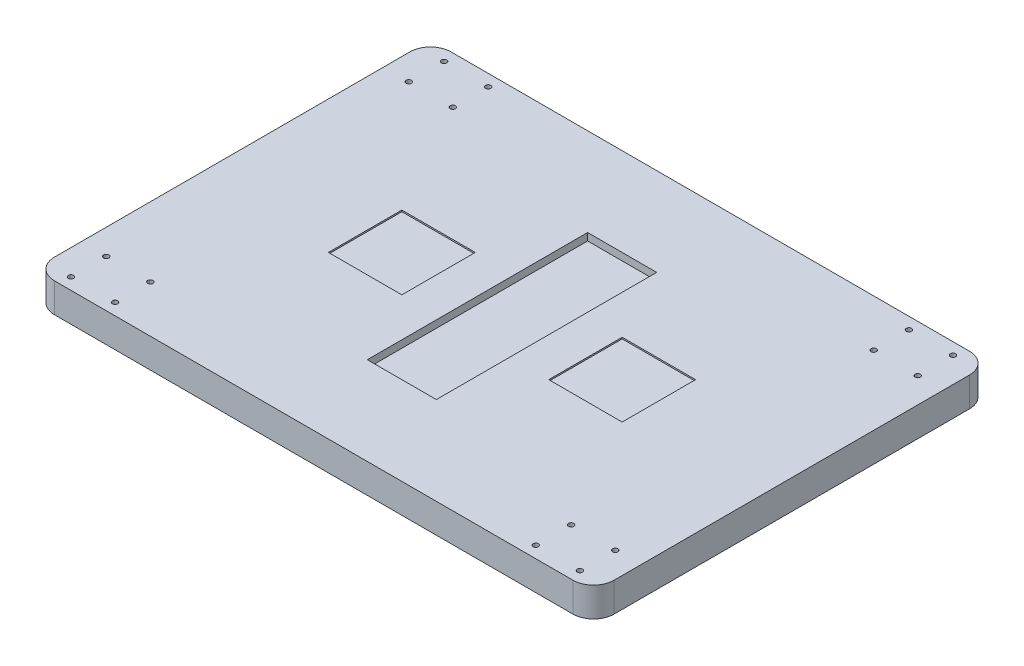
from build123d import *

# Parameters (mm, degrees)
SKETCH1_W                    = 381.012396694
SKETCH1_H                    = 270
BOSS_EXTRUDE1_DEPTH          = 20
FILLET1_R                    = 14
SKETCH2_W                    = 47
SKETCH2_H                    = 150
CUT_EXTRUDE1_DEPTH           = 5
M3_CLEARANCE_HOLE1_OUTLINE_R = 1.8
M3_CLEARANCE_HOLE1_DEPTH     = 20
SKETCH2_4_W                  = 47
SKETCH2_4_H                  = 150
SKETCH2_4_W_2                = 50
SKETCH2_4_H_2                = 50
CUT_EXTRUDE2_DEPTH           = 1
SKETCH5_W                    = 1.221153846
SKETCH5_H                    = 6.960576923
SKETCH5_H_2                  = 9.769230769
CUT_EXTRUDE3_DEPTH           = 2


# Read off the part's stored shape, not the designer's step: M3 Clearance Hole1
with BuildPart() as part:
    # Sketch1 → Boss-Extrude1 (new body)
    with BuildSketch(Plane(origin=(0, 0, 0), x_dir=(1, 0, 0), z_dir=(0, 1, 0))):
        with Locations((190.506198347, 135)):
            Rectangle(SKETCH1_W, SKETCH1_H)
    extrude(amount=BOSS_EXTRUDE1_DEPTH)

    # Fillet1
    fillet1_edges = [part.edges().sort_by_distance(p)[0] for p in [
        (0, 10, -270),
        (381.012396694, 10, -270),
        (381.012396694, 10, 0),
        (0, 10, 0),
    ]]
    fillet(fillet1_edges, radius=FILLET1_R)

    # Sketch2 → Cut-Extrude1 (cut)
    with BuildSketch(Plane(origin=(0, 20, 0), x_dir=(1, 0, 0), z_dir=(0, 1, 0))):
        with Locations((190.506198347, 135)):
            Rectangle(SKETCH2_W, SKETCH2_H)
    extrude(amount=-CUT_EXTRUDE1_DEPTH, mode=Mode.SUBTRACT)

    # M3 Clearance Hole1 outline → M3 Clearance Hole1 (cut)
    with BuildSketch(Plane(origin=(0, 0, 0), x_dir=(1, 0, 0), z_dir=(0, 1, 0))):
        with Locations((333.753629118, 238)):
            Circle(M3_CLEARANCE_HOLE1_OUTLINE_R)
        with Locations((333.753629118, 262)):
            Circle(M3_CLEARANCE_HOLE1_OUTLINE_R)
        with Locations((363.753629118, 262)):
            Circle(M3_CLEARANCE_HOLE1_OUTLINE_R)
        with Locations((363.753629118, 238)):
            Circle(M3_CLEARANCE_HOLE1_OUTLINE_R)
        with Locations((363.753629118, 32)):
            Circle(M3_CLEARANCE_HOLE1_OUTLINE_R)
        with Locations((363.753629118, 8)):
            Circle(M3_CLEARANCE_HOLE1_OUTLINE_R)
        with Locations((333.753629118, 32)):
            Circle(M3_CLEARANCE_HOLE1_OUTLINE_R)
        with Locations((333.753629118, 8)):
            Circle(M3_CLEARANCE_HOLE1_OUTLINE_R)
        with Locations((17.258767576, 8)):
            Circle(M3_CLEARANCE_HOLE1_OUTLINE_R)
        with Locations((17.258767576, 32)):
            Circle(M3_CLEARANCE_HOLE1_OUTLINE_R)
        with Locations((47.258767576, 32)):
            Circle(M3_CLEARANCE_HOLE1_OUTLINE_R)
        with Locations((47.258767576, 8)):
            Circle(M3_CLEARANCE_HOLE1_OUTLINE_R)
        with Locations((17.258767576, 238)):
            Circle(M3_CLEARANCE_HOLE1_OUTLINE_R)
        with Locations((47.258767576, 238)):
            Circle(M3_CLEARANCE_HOLE1_OUTLINE_R)
        with Locations((47.258767576, 262)):
            Circle(M3_CLEARANCE_HOLE1_OUTLINE_R)
        with Locations((17.258767576, 262)):
            Circle(M3_CLEARANCE_HOLE1_OUTLINE_R)
    extrude(amount=M3_CLEARANCE_HOLE1_DEPTH, mode=Mode.SUBTRACT)

    # Sketch2<4> → Cut-Extrude2 (cut)
    with BuildSketch(Plane(origin=(0, 20, 0), x_dir=(1, 0, 0), z_dir=(0, 1, 0))):
        with Locations((190.506198347, 135)):
            Rectangle(SKETCH2_4_W, SKETCH2_4_H)
        with Locations((115.506198347, 135)):
            Rectangle(SKETCH2_4_W_2, SKETCH2_4_H_2)
        with Locations((265.506198347, 135)):
            Rectangle(SKETCH2_4_W_2, SKETCH2_4_H_2)
    extrude(amount=-CUT_EXTRUDE2_DEPTH, mode=Mode.SUBTRACT)

    # Sketch5 → Cut-Extrude3 (cut)
    # profile 1 of 17: a face of its own
    with BuildSketch(Plane.XZ):
        Polygon((285.402063732, -143.548076923), (285.402063732, -144.525), (278.807832962, -144.525), (278.807832962, -143.548076923), (281.494371424, -143.548076923), (281.494371424, -135), (282.71552527, -135), (282.71552527, -143.548076923), align=None)
    # profile 2 of 17: a face of its own
    with BuildSketch(Plane.XZ):
        with BuildLine():
            Line((273.117256039, -144.769230769), (271.896102193, -144.769230769))
            Line((271.896102193, -144.769230769), (271.896102193, -140.645928486))
            add(Edge.make_bspline(
                [(271.896102193, -140.645928486), (271.780014918, -140.760952766), (271.551864203, -140.987014337), (271.176000165, -141.27978998), (270.784628752, -141.529070626), (270.3755603, -141.733037024), (269.948950475, -141.891050043), (269.504611539, -142.000325328), (269.04320053, -142.069784476), (268.729621089, -142.07834483), (268.570366015, -142.082692308)],
                knots=[0, 0, 0, 0, 1.051262509, 2.066085983, 3.059970449, 4.034092793, 5.003064597, 5.982190548, 6.97523131, 8, 8, 8, 8], degree=3))
            add(Edge.make_bspline(
                [(268.570366015, -142.082692308), (268.488910888, -142.081802444), (268.327677506, -142.080041036), (268.089576058, -142.059699538), (267.857438811, -142.030346778), (267.633123283, -141.985011687), (267.414180729, -141.933611041), (267.204519243, -141.863594611), (267.00137579, -141.783210651), (266.805246882, -141.692422663), (266.619497674, -141.589737099), (266.445424787, -141.479008274), (266.28309114, -141.360337991), (266.135799184, -141.230618719), (265.998467788, -141.094404804), (265.874746793, -140.94951171), (265.763055454, -140.796155941), (265.664507992, -140.631565948), (265.576537365, -140.450920967), (265.50374002, -140.248425913), (265.440421291, -140.023398474), (265.389654253, -139.77463301), (265.350344709, -139.502557209), (265.322043749, -139.207113698), (265.304890939, -138.888816609), (265.302900506, -138.668572048), (265.301871424, -138.554702524)],
                knots=[0, 0, 0, 0, 1.060090248, 2.098357, 3.108919151, 4.104307657, 5.07624491, 6.034544251, 6.978573164, 7.919437909, 8.84587468, 9.739351658, 10.603775763, 11.460552766, 12.291908634, 13.11991816, 13.938057932, 14.758791128, 15.614206832, 16.549371086, 17.555888866, 18.655217294, 19.85191054, 21.133015649, 22.517728915, 24, 24, 24, 24], degree=3))
            Line((265.301871424, -138.554702524), (265.301871424, -135))
            Line((265.301871424, -135), (266.52302527, -135))
            Line((266.52302527, -135), (266.52302527, -138.27421875))
            add(Edge.make_bspline(
                [(266.52302527, -138.27421875), (266.523358308, -138.368988372), (266.523995394, -138.550278221), (266.529670291, -138.809816467), (266.538982004, -139.044559748), (266.55189651, -139.255185674), (266.569343727, -139.440888527), (266.587299614, -139.602826865), (266.610744878, -139.739484534), (266.633147226, -139.821141339), (266.643232602, -139.857902644)],
                knots=[0, 0, 0, 0, 1.428537637, 2.732725584, 3.912935555, 4.969670097, 5.9131778, 6.72419638, 7.425642407, 8, 8, 8, 8], degree=3))
            add(Edge.make_bspline(
                [(266.643232602, -139.857902644), (266.661326438, -139.913599272), (266.696848091, -140.022942377), (266.766107066, -140.178114025), (266.846945566, -140.321786736), (266.936867193, -140.455805071), (267.035865739, -140.580745959), (267.147111922, -140.694029426), (267.270322152, -140.794708592), (267.402057161, -140.88765354), (267.546186172, -140.966804894), (267.699268447, -141.038439311), (267.864144675, -141.097453489), (268.039930005, -141.144174932), (268.225767811, -141.183074196), (268.422185568, -141.209162371), (268.629274656, -141.224318158), (268.770685584, -141.226675497), (268.843217578, -141.227884615)],
                knots=[0, 0, 0, 0, 1.001490693, 1.966117279, 2.901573967, 3.81913531, 4.725005841, 5.625368712, 6.529669049, 7.444386435, 8.379843123, 9.339052492, 10.333898936, 11.371400841, 12.449213347, 13.58042335, 14.758959286, 16, 16, 16, 16], degree=3))
            add(Edge.make_bspline(
                [(268.843217578, -141.227884615), (268.927234004, -141.226581337), (269.0937354, -141.223998537), (269.339897084, -141.198454024), (269.579151214, -141.156920603), (269.810989528, -141.096976221), (270.03653407, -141.02222274), (270.257135059, -140.933638225), (270.468403599, -140.823466266), (270.67236624, -140.70062594), (270.862493319, -140.56311729), (271.041825004, -140.421643249), (271.200130943, -140.267679127), (271.342388489, -140.107356303), (271.466504507, -139.938147018), (271.576833993, -139.762728805), (271.666434689, -139.577302143), (271.712753643, -139.448742737), (271.735825751, -139.384705529)],
                knots=[0, 0, 0, 0, 1.103287364, 2.186463942, 3.246815051, 4.290346497, 5.328614237, 6.366512181, 7.408972927, 8.454909442, 9.491158513, 10.489291136, 11.452369341, 12.387614776, 13.301610865, 14.205779579, 15.106274132, 16, 16, 16, 16], degree=3))
            add(Edge.make_bspline(
                [(271.735825751, -139.384705529), (271.749265957, -139.338453725), (271.778446809, -139.238033613), (271.809237099, -139.071238297), (271.835270681, -138.877583188), (271.858222023, -138.65744647), (271.874423968, -138.409832043), (271.888070654, -138.136333455), (271.895523588, -137.835408089), (271.89590357, -137.62612049), (271.896102193, -137.516721755)],
                knots=[0, 0, 0, 0, 0.614456878, 1.334084809, 2.161847829, 3.108567613, 4.158342329, 5.328722656, 6.603670911, 8, 8, 8, 8], degree=3))
            Line((271.896102193, -137.516721755), (271.896102193, -135))
            Line((271.896102193, -135), (273.117256039, -135))
            Line((273.117256039, -135), (273.117256039, -144.769230769))
        make_face()
    # profile 3 of 17: a face of its own
    with BuildSketch(Plane.XZ):
        with BuildLine():
            add(Edge.make_bspline(
                [(258.271841376, -144.891346154), (258.206106521, -144.888995765), (258.079043266, -144.884452543), (257.895164397, -144.842961607), (257.726869925, -144.774367158), (257.577160113, -144.681040047), (257.449402739, -144.571707239), (257.360916191, -144.441756282), (257.299436555, -144.303148964), (257.293890264, -144.204451875), (257.291102193, -144.15483774)],
                knots=[0, 0, 0, 0, 1.161947567, 2.246005398, 3.316126401, 4.362425386, 5.358802161, 6.264259363, 7.127458868, 8, 8, 8, 8], degree=3))
            add(Edge.make_bspline(
                [(257.291102193, -144.15483774), (257.293973185, -144.106507578), (257.299723961, -144.009699254), (257.360918257, -143.873495196), (257.450070468, -143.745461882), (257.577080828, -143.636207721), (257.726892135, -143.542957321), (257.895158345, -143.474341511), (258.079044915, -143.432856396), (258.206107083, -143.428312352), (258.271841376, -143.425961538)],
                knots=[0, 0, 0, 0, 0.854671362, 1.711959949, 2.612933713, 3.614565716, 4.666383233, 5.742148414, 6.831923931, 8, 8, 8, 8], degree=3))
            add(Edge.make_bspline(
                [(258.271841376, -143.425961538), (258.336286784, -143.428384651), (258.461421471, -143.433089646), (258.642439765, -143.473859743), (258.808039887, -143.544012729), (258.957263666, -143.635990984), (259.083804028, -143.746119059), (259.175389731, -143.872853303), (259.236226487, -144.009771898), (259.242044025, -144.106531768), (259.244948347, -144.15483774)],
                knots=[0, 0, 0, 0, 1.152406297, 2.237645894, 3.298861306, 4.35702004, 5.3646907, 6.277718956, 7.14017598, 8, 8, 8, 8], degree=3))
            add(Edge.make_bspline(
                [(259.244948347, -144.15483774), (259.242125721, -144.204427167), (259.23651069, -144.303075105), (259.175401077, -144.442395072), (259.084469609, -144.571058542), (258.957183664, -144.681254576), (258.808061808, -144.773311988), (258.642433776, -144.843443298), (258.461423092, -144.884219305), (258.336287335, -144.88892347), (258.271841376, -144.891346154)],
                knots=[0, 0, 0, 0, 0.877781059, 1.746164392, 2.663580443, 3.665940824, 4.718523215, 5.774146176, 6.853666717, 8, 8, 8, 8], degree=3))
        make_face()
    # profile 4 of 17: a face of its own
    with BuildSketch(Plane.XZ):
        with Locations((258.26802527, -138.480288462)):
            Rectangle(SKETCH5_W, SKETCH5_H)
    # profile 5 of 17: a face of its own
    with BuildSketch(Plane.XZ):
        with BuildLine():
            Line((246.83802527, -141.092412861), (247.578349789, -140.495192308))
            add(Edge.make_bspline(
                [(247.578349789, -140.495192308), (247.645634011, -140.55338161), (247.776250481, -140.666342437), (247.97922631, -140.815307813), (248.180114853, -140.942733972), (248.381101981, -141.046596605), (248.581225487, -141.126807366), (248.779751606, -141.18514809), (248.97754505, -141.221153983), (249.109735789, -141.225651075), (249.175390054, -141.227884615)],
                knots=[0, 0, 0, 0, 1.187891683, 2.306011931, 3.359687364, 4.362827326, 5.323627033, 6.235078112, 7.123428389, 8, 8, 8, 8], degree=3))
            add(Edge.make_bspline(
                [(249.175390054, -141.227884615), (249.255227882, -141.224969609), (249.411086243, -141.219278973), (249.635477559, -141.163472399), (249.842400126, -141.075596177), (250.026205891, -140.954069554), (250.179330044, -140.809326221), (250.296785791, -140.650059504), (250.365407952, -140.473636744), (250.374709117, -140.352001566), (250.379371424, -140.291030649)],
                knots=[0, 0, 0, 0, 1.136779825, 2.219206672, 3.275667648, 4.329789593, 5.343525384, 6.267229628, 7.131430556, 8, 8, 8, 8], degree=3))
            add(Edge.make_bspline(
                [(250.379371424, -140.291030649), (250.375702533, -140.235812529), (250.368293736, -140.124307464), (250.305684681, -139.961101483), (250.206853353, -139.802743587), (250.117320188, -139.708823816), (250.070266857, -139.659465144)],
                knots=[0, 0, 0, 0, 0.915304622, 1.848326266, 2.869207656, 4, 4, 4, 4], degree=3))
            add(Edge.make_bspline(
                [(250.070266857, -139.659465144), (250.041425759, -139.632898502), (249.979165819, -139.575548481), (249.86964631, -139.494298506), (249.7389146, -139.41083209), (249.587586182, -139.322622898), (249.414291356, -139.23258368), (249.221157818, -139.135865337), (249.005240839, -139.039714966), (248.853669264, -138.975495992), (248.774698948, -138.94203726)],
                knots=[0, 0, 0, 0, 0.63212743, 1.364588004, 2.195464086, 3.133262597, 4.188693409, 5.344814424, 6.6166216, 8, 8, 8, 8], degree=3))
            add(Edge.make_bspline(
                [(248.774698948, -138.94203726), (248.678452462, -138.900528409), (248.492586467, -138.820368767), (248.227277181, -138.696923902), (247.986182867, -138.573593153), (247.771115462, -138.448446428), (247.576850865, -138.329895725), (247.408389051, -138.208849289), (247.262247991, -138.090326949), (247.17888087, -138.005287464), (247.139497626, -137.965114183)],
                knots=[0, 0, 0, 0, 1.312114962, 2.533885256, 3.662744578, 4.700700231, 5.648498512, 6.510216311, 7.296215166, 8, 8, 8, 8], degree=3))
            add(Edge.make_bspline(
                [(247.139497626, -137.965114183), (247.074397951, -137.885311539), (246.94706695, -137.729222428), (246.816898968, -137.460981672), (246.730229677, -137.180544723), (246.720721137, -136.986936625), (246.715909886, -136.888972356)],
                knots=[0, 0, 0, 0, 1.042420968, 2.038911939, 3.007703917, 4, 4, 4, 4], degree=3))
            add(Edge.make_bspline(
                [(246.715909886, -136.888972356), (246.717852178, -136.82009876), (246.721692854, -136.68390852), (246.760152838, -136.484264749), (246.81797436, -136.291801528), (246.90501156, -136.109681688), (247.008704476, -135.931898671), (247.142338254, -135.766248042), (247.29896498, -135.609268219), (247.474762947, -135.459156601), (247.669402529, -135.323740265), (247.87746965, -135.204268357), (248.097437086, -135.102395232), (248.330582083, -135.021703256), (248.574484587, -134.955494837), (248.830564039, -134.910523349), (249.098487672, -134.883598406), (249.280905334, -134.879812916), (249.373827554, -134.877884615)],
                knots=[0, 0, 0, 0, 0.892388946, 1.764604599, 2.628351177, 3.492097755, 4.376403335, 5.292503137, 6.243418865, 7.25013864, 8.286935251, 9.314334271, 10.359011649, 11.426217399, 12.510883189, 13.633993454, 14.794773606, 16, 16, 16, 16], degree=3))
            add(Edge.make_bspline(
                [(249.373827554, -134.877884615), (249.499289436, -134.880561525), (249.747959543, -134.885867259), (250.116146137, -134.936195362), (250.47602713, -135.013164756), (250.822933272, -135.124066728), (251.151499581, -135.259889658), (251.454659946, -135.419957043), (251.728683152, -135.604319201), (251.888318319, -135.74917986), (251.966871424, -135.82046274)],
                knots=[0, 0, 0, 0, 1.06569098, 2.112239068, 3.152290447, 4.18992323, 5.202764126, 6.169967771, 7.099479667, 8, 8, 8, 8], degree=3))
            Line((251.966871424, -135.82046274), (251.243719381, -136.465384615))
            add(Edge.make_bspline(
                [(251.243719381, -136.465384615), (251.175247465, -136.407070637), (251.041455187, -136.293126695), (250.830305142, -136.143617347), (250.616075646, -136.016784142), (250.397733859, -135.91304354), (250.175969929, -135.832609092), (249.951121377, -135.774947059), (249.723506452, -135.739332575), (249.570482197, -135.73490448), (249.494034886, -135.732692308)],
                knots=[0, 0, 0, 0, 1.111927383, 2.17267613, 3.195288797, 4.187559573, 5.158013992, 6.108138625, 7.054870644, 8, 8, 8, 8], degree=3))
            add(Edge.make_bspline(
                [(249.494034886, -135.732692308), (249.390006824, -135.736420714), (249.18755855, -135.74367654), (248.8966992, -135.808747708), (248.628111891, -135.911634099), (248.427655215, -136.034896154), (248.285742241, -136.148866862), (248.19214936, -136.237376868), (248.114144668, -136.330333282), (248.0501301, -136.427930414), (247.997734453, -136.527527169), (247.963429836, -136.633450936), (247.941873866, -136.741807843), (247.938667901, -136.815730596), (247.937063732, -136.852719351)],
                knots=[0, 0, 0, 0, 1.76855631, 3.441774896, 5.045983248, 6.644520092, 7.422219082, 8.141926103, 8.833567701, 9.482099588, 10.126007141, 10.742200638, 11.370634467, 12, 12, 12, 12], degree=3))
            add(Edge.make_bspline(
                [(247.937063732, -136.852719351), (247.940546117, -136.913660733), (247.947452388, -137.034519765), (248.009585186, -137.208967581), (248.105198032, -137.374372353), (248.195610372, -137.468209407), (248.242352193, -137.516721755)],
                knots=[0, 0, 0, 0, 0.970753053, 1.925198784, 2.927358944, 4, 4, 4, 4], degree=3))
            add(Edge.make_bspline(
                [(248.242352193, -137.516721755), (248.271203039, -137.541416556), (248.334794903, -137.595847836), (248.448901318, -137.672614402), (248.585039863, -137.756721006), (248.74748448, -137.840808614), (248.929483041, -137.936152411), (249.138984503, -138.029903774), (249.371113493, -138.131086351), (249.534622571, -138.198804206), (249.619966376, -138.234149639)],
                knots=[0, 0, 0, 0, 0.584144934, 1.28754858, 2.113654268, 3.046613042, 4.10183206, 5.2758917, 6.578147661, 8, 8, 8, 8], degree=3))
            add(Edge.make_bspline(
                [(249.619966376, -138.234149639), (249.712504056, -138.273511029), (249.890654115, -138.349288097), (250.143579755, -138.470425673), (250.373797167, -138.590304531), (250.582573801, -138.707296692), (250.766682625, -138.826752515), (250.929272319, -138.943485411), (251.067868898, -139.062261406), (251.148234315, -139.144991309), (251.186477794, -139.184359976)],
                knots=[0, 0, 0, 0, 1.307990047, 2.518093226, 3.646744414, 4.68422955, 5.629722174, 6.500166002, 7.286274211, 8, 8, 8, 8], degree=3))
            add(Edge.make_bspline(
                [(251.186477794, -139.184359976), (251.250063204, -139.263008324), (251.37460902, -139.417058173), (251.505414168, -139.682013822), (251.58493324, -139.963968448), (251.595280226, -140.158217769), (251.60052527, -140.256685697)],
                knots=[0, 0, 0, 0, 1.03036624, 2.018195775, 2.995393363, 4, 4, 4, 4], degree=3))
            add(Edge.make_bspline(
                [(251.60052527, -140.256685697), (251.599159404, -140.321097241), (251.596476702, -140.44760811), (251.561367153, -140.632208838), (251.511360729, -140.809938871), (251.434816848, -140.97786524), (251.342147377, -141.140305466), (251.223259637, -141.290437567), (251.087808269, -141.435619992), (250.929074342, -141.566799389), (250.757493779, -141.688572652), (250.572486567, -141.79385898), (250.377540564, -141.884351798), (250.170117204, -141.956161991), (249.952168343, -142.014189642), (249.722184146, -142.052993576), (249.481916141, -142.079053344), (249.317930051, -142.081465617), (249.234539693, -142.082692308)],
                knots=[0, 0, 0, 0, 0.926790944, 1.820312323, 2.6990465, 3.581215108, 4.472477501, 5.38722695, 6.333746693, 7.328848171, 8.348464033, 9.362462589, 10.391753375, 11.441047168, 12.521420338, 13.637924818, 14.798835342, 16, 16, 16, 16], degree=3))
            add(Edge.make_bspline(
                [(249.234539693, -142.082692308), (249.135154917, -142.079701538), (248.935348052, -142.073688784), (248.635353991, -142.025996715), (248.335323382, -141.947141364), (248.034704398, -141.837483404), (247.734210569, -141.697363425), (247.43404065, -141.525641076), (247.131072003, -141.325996211), (246.937351505, -141.171584379), (246.83802527, -141.092412861)],
                knots=[0, 0, 0, 0, 0.901438579, 1.812285774, 2.748697099, 3.712587738, 4.71176503, 5.753243045, 6.848021186, 8, 8, 8, 8], degree=3))
        make_face()
    # profile 6 of 17: a face of its own
    with BuildSketch(Plane.XZ):
        with BuildLine():
            add(Edge.make_bspline(
                [(231.308764453, -144.891346154), (231.243029598, -144.888995765), (231.115966342, -144.884452543), (230.932087474, -144.842961607), (230.763793002, -144.774367158), (230.614083189, -144.681040047), (230.486325816, -144.571707239), (230.397839268, -144.441756282), (230.336359632, -144.303148964), (230.330813341, -144.204451875), (230.32802527, -144.15483774)],
                knots=[0, 0, 0, 0, 1.161947567, 2.246005398, 3.316126401, 4.362425386, 5.358802161, 6.264259363, 7.127458868, 8, 8, 8, 8], degree=3))
            add(Edge.make_bspline(
                [(230.32802527, -144.15483774), (230.330896262, -144.106507578), (230.336647038, -144.009699254), (230.397841334, -143.873495196), (230.486993545, -143.745461882), (230.614003905, -143.636207721), (230.763815212, -143.542957321), (230.932081422, -143.474341511), (231.115967992, -143.432856396), (231.24303016, -143.428312352), (231.308764453, -143.425961538)],
                knots=[0, 0, 0, 0, 0.854671362, 1.711959949, 2.612933713, 3.614565716, 4.666383233, 5.742148414, 6.831923931, 8, 8, 8, 8], degree=3))
            add(Edge.make_bspline(
                [(231.308764453, -143.425961538), (231.373209861, -143.428384651), (231.498344548, -143.433089646), (231.679362842, -143.473859743), (231.844962964, -143.544012729), (231.994186743, -143.635990984), (232.120727105, -143.746119059), (232.212312808, -143.872853303), (232.273149564, -144.009771898), (232.278967102, -144.106531768), (232.281871424, -144.15483774)],
                knots=[0, 0, 0, 0, 1.152406297, 2.237645894, 3.298861306, 4.35702004, 5.3646907, 6.277718956, 7.14017598, 8, 8, 8, 8], degree=3))
            add(Edge.make_bspline(
                [(232.281871424, -144.15483774), (232.279048798, -144.204427167), (232.273433767, -144.303075105), (232.212324154, -144.442395072), (232.121392686, -144.571058542), (231.994106741, -144.681254576), (231.844984885, -144.773311988), (231.679356853, -144.843443298), (231.498346169, -144.884219305), (231.373210412, -144.88892347), (231.308764453, -144.891346154)],
                knots=[0, 0, 0, 0, 0.877781059, 1.746164392, 2.663580443, 3.665940824, 4.718523215, 5.774146176, 6.853666717, 8, 8, 8, 8], degree=3))
        make_face()
    # profile 7 of 17: a face of its own
    with BuildSketch(Plane.XZ):
        with Locations((231.304948347, -138.480288462)):
            Rectangle(SKETCH5_W, SKETCH5_H)
    # profile 8 of 17: a face of its own
    with BuildSketch(Plane.XZ):
        with BuildLine():
            Line((219.874948347, -141.092412861), (220.615272866, -140.495192308))
            add(Edge.make_bspline(
                [(220.615272866, -140.495192308), (220.682557088, -140.55338161), (220.813173558, -140.666342437), (221.016149387, -140.815307813), (221.21703793, -140.942733972), (221.418025058, -141.046596605), (221.618148564, -141.126807366), (221.816674683, -141.18514809), (222.014468127, -141.221153983), (222.146658866, -141.225651075), (222.212313131, -141.227884615)],
                knots=[0, 0, 0, 0, 1.187891683, 2.306011931, 3.359687364, 4.362827326, 5.323627033, 6.235078112, 7.123428389, 8, 8, 8, 8], degree=3))
            add(Edge.make_bspline(
                [(222.212313131, -141.227884615), (222.292150959, -141.224969609), (222.44800932, -141.219278973), (222.672400636, -141.163472399), (222.879323203, -141.075596177), (223.063128968, -140.954069554), (223.216253121, -140.809326221), (223.333708868, -140.650059504), (223.402331029, -140.473636744), (223.411632194, -140.352001566), (223.416294501, -140.291030649)],
                knots=[0, 0, 0, 0, 1.136779825, 2.219206672, 3.275667648, 4.329789593, 5.343525384, 6.267229628, 7.131430556, 8, 8, 8, 8], degree=3))
            add(Edge.make_bspline(
                [(223.416294501, -140.291030649), (223.41262561, -140.235812529), (223.405216813, -140.124307464), (223.342607758, -139.961101483), (223.24377643, -139.802743587), (223.154243265, -139.708823816), (223.107189934, -139.659465144)],
                knots=[0, 0, 0, 0, 0.915304622, 1.848326266, 2.869207656, 4, 4, 4, 4], degree=3))
            add(Edge.make_bspline(
                [(223.107189934, -139.659465144), (223.078348836, -139.632898502), (223.016088896, -139.575548481), (222.906569386, -139.494298506), (222.775837677, -139.41083209), (222.624509259, -139.322622898), (222.451214433, -139.23258368), (222.258080895, -139.135865337), (222.042163916, -139.039714966), (221.890592341, -138.975495992), (221.811622025, -138.94203726)],
                knots=[0, 0, 0, 0, 0.63212743, 1.364588004, 2.195464086, 3.133262597, 4.188693409, 5.344814424, 6.6166216, 8, 8, 8, 8], degree=3))
            add(Edge.make_bspline(
                [(221.811622025, -138.94203726), (221.715375539, -138.900528409), (221.529509543, -138.820368767), (221.264200258, -138.696923902), (221.023105944, -138.573593153), (220.808038538, -138.448446428), (220.613773942, -138.329895725), (220.445312128, -138.208849289), (220.299171068, -138.090326949), (220.215803947, -138.005287464), (220.176420703, -137.965114183)],
                knots=[0, 0, 0, 0, 1.312114962, 2.533885256, 3.662744578, 4.700700231, 5.648498512, 6.510216311, 7.296215166, 8, 8, 8, 8], degree=3))
            add(Edge.make_bspline(
                [(220.176420703, -137.965114183), (220.111321028, -137.885311539), (219.983990027, -137.729222428), (219.853822045, -137.460981672), (219.767152754, -137.180544723), (219.757644214, -136.986936625), (219.752832962, -136.888972356)],
                knots=[0, 0, 0, 0, 1.042420968, 2.038911939, 3.007703917, 4, 4, 4, 4], degree=3))
            add(Edge.make_bspline(
                [(219.752832962, -136.888972356), (219.754775254, -136.82009876), (219.758615931, -136.68390852), (219.797075915, -136.484264749), (219.854897437, -136.291801528), (219.941934637, -136.109681688), (220.045627553, -135.931898671), (220.179261331, -135.766248042), (220.335888056, -135.609268219), (220.511686024, -135.459156601), (220.706325606, -135.323740265), (220.914392727, -135.204268357), (221.134360163, -135.102395232), (221.36750516, -135.021703256), (221.611407664, -134.955494837), (221.867487116, -134.910523349), (222.135410749, -134.883598406), (222.317828411, -134.879812916), (222.410750631, -134.877884615)],
                knots=[0, 0, 0, 0, 0.892388946, 1.764604599, 2.628351177, 3.492097755, 4.376403335, 5.292503137, 6.243418865, 7.25013864, 8.286935251, 9.314334271, 10.359011649, 11.426217399, 12.510883189, 13.633993454, 14.794773606, 16, 16, 16, 16], degree=3))
            add(Edge.make_bspline(
                [(222.410750631, -134.877884615), (222.536212513, -134.880561525), (222.78488262, -134.885867259), (223.153069214, -134.936195362), (223.512950207, -135.013164756), (223.859856348, -135.124066728), (224.188422658, -135.259889658), (224.491583023, -135.419957043), (224.765606229, -135.604319201), (224.925241396, -135.74917986), (225.003794501, -135.82046274)],
                knots=[0, 0, 0, 0, 1.06569098, 2.112239068, 3.152290447, 4.18992323, 5.202764126, 6.169967771, 7.099479667, 8, 8, 8, 8], degree=3))
            Line((225.003794501, -135.82046274), (224.280642458, -136.465384615))
            add(Edge.make_bspline(
                [(224.280642458, -136.465384615), (224.212170542, -136.407070637), (224.078378264, -136.293126695), (223.867228219, -136.143617347), (223.652998723, -136.016784142), (223.434656936, -135.91304354), (223.212893006, -135.832609092), (222.988044454, -135.774947059), (222.760429529, -135.739332575), (222.607405274, -135.73490448), (222.530957962, -135.732692308)],
                knots=[0, 0, 0, 0, 1.111927383, 2.17267613, 3.195288797, 4.187559573, 5.158013992, 6.108138625, 7.054870644, 8, 8, 8, 8], degree=3))
            add(Edge.make_bspline(
                [(222.530957962, -135.732692308), (222.426929901, -135.736420714), (222.224481627, -135.74367654), (221.933622277, -135.808747708), (221.665034968, -135.911634099), (221.464578292, -136.034896154), (221.322665318, -136.148866862), (221.229072437, -136.237376868), (221.151067745, -136.330333282), (221.087053177, -136.427930414), (221.03465753, -136.527527169), (221.000352913, -136.633450936), (220.978796943, -136.741807843), (220.975590978, -136.815730596), (220.973986809, -136.852719351)],
                knots=[0, 0, 0, 0, 1.76855631, 3.441774896, 5.045983248, 6.644520092, 7.422219082, 8.141926103, 8.833567701, 9.482099588, 10.126007141, 10.742200638, 11.370634467, 12, 12, 12, 12], degree=3))
            add(Edge.make_bspline(
                [(220.973986809, -136.852719351), (220.977469194, -136.913660733), (220.984375465, -137.034519765), (221.046508263, -137.208967581), (221.142121108, -137.374372353), (221.232533449, -137.468209407), (221.27927527, -137.516721755)],
                knots=[0, 0, 0, 0, 0.970753053, 1.925198784, 2.927358944, 4, 4, 4, 4], degree=3))
            add(Edge.make_bspline(
                [(221.27927527, -137.516721755), (221.308126116, -137.541416556), (221.37171798, -137.595847836), (221.485824395, -137.672614402), (221.62196294, -137.756721006), (221.784407557, -137.840808614), (221.966406118, -137.936152411), (222.17590758, -138.029903774), (222.40803657, -138.131086351), (222.571545648, -138.198804206), (222.656889453, -138.234149639)],
                knots=[0, 0, 0, 0, 0.584144934, 1.28754858, 2.113654268, 3.046613042, 4.10183206, 5.2758917, 6.578147661, 8, 8, 8, 8], degree=3))
            add(Edge.make_bspline(
                [(222.656889453, -138.234149639), (222.749427133, -138.273511029), (222.927577192, -138.349288097), (223.180502832, -138.470425673), (223.410720244, -138.590304531), (223.619496878, -138.707296692), (223.803605702, -138.826752515), (223.966195396, -138.943485411), (224.104791975, -139.062261406), (224.185157392, -139.144991309), (224.223400871, -139.184359976)],
                knots=[0, 0, 0, 0, 1.307990047, 2.518093226, 3.646744414, 4.68422955, 5.629722174, 6.500166002, 7.286274211, 8, 8, 8, 8], degree=3))
            add(Edge.make_bspline(
                [(224.223400871, -139.184359976), (224.28698628, -139.263008324), (224.411532097, -139.417058173), (224.542337245, -139.682013822), (224.621856317, -139.963968448), (224.632203303, -140.158217769), (224.637448347, -140.256685697)],
                knots=[0, 0, 0, 0, 1.03036624, 2.018195775, 2.995393363, 4, 4, 4, 4], degree=3))
            add(Edge.make_bspline(
                [(224.637448347, -140.256685697), (224.636082481, -140.321097241), (224.633399779, -140.44760811), (224.59829023, -140.632208838), (224.548283806, -140.809938871), (224.471739924, -140.97786524), (224.379070454, -141.140305466), (224.260182714, -141.290437567), (224.124731345, -141.435619992), (223.965997419, -141.566799389), (223.794416856, -141.688572652), (223.609409644, -141.79385898), (223.414463641, -141.884351798), (223.207040281, -141.956161991), (222.98909142, -142.014189642), (222.759107223, -142.052993576), (222.518839218, -142.079053344), (222.354853128, -142.081465617), (222.27146277, -142.082692308)],
                knots=[0, 0, 0, 0, 0.926790944, 1.820312323, 2.6990465, 3.581215108, 4.472477501, 5.38722695, 6.333746693, 7.328848171, 8.348464033, 9.362462589, 10.391753375, 11.441047168, 12.521420338, 13.637924818, 14.798835342, 16, 16, 16, 16], degree=3))
            add(Edge.make_bspline(
                [(222.27146277, -142.082692308), (222.172077994, -142.079701538), (221.972271129, -142.073688784), (221.672277068, -142.025996715), (221.372246459, -141.947141364), (221.071627475, -141.837483404), (220.771133646, -141.697363425), (220.470963727, -141.525641076), (220.16799508, -141.325996211), (219.974274582, -141.171584379), (219.874948347, -141.092412861)],
                knots=[0, 0, 0, 0, 0.901438579, 1.812285774, 2.748697099, 3.712587738, 4.71176503, 5.753243045, 6.848021186, 8, 8, 8, 8], degree=3))
        make_face()
    # profile 9 of 17: a face of its own
    with BuildSketch(Plane.XZ):
        with BuildLine():
            Line((205.196679116, -141.960576923), (203.97552527, -141.960576923))
            Line((203.97552527, -141.960576923), (203.97552527, -140.935952524))
            add(Edge.make_bspline(
                [(203.97552527, -140.935952524), (203.889484983, -141.031760381), (203.723042845, -141.217097565), (203.452065375, -141.459852537), (203.173042153, -141.659592436), (202.886388266, -141.817694267), (202.593924212, -141.936679571), (202.295867001, -142.021501108), (201.990989045, -142.072356914), (201.785268156, -142.079239103), (201.682045703, -142.082692308)],
                knots=[0, 0, 0, 0, 1.165123147, 2.253892832, 3.285998974, 4.265245787, 5.210434991, 6.138153436, 7.065800409, 8, 8, 8, 8], degree=3))
            add(Edge.make_bspline(
                [(201.682045703, -142.082692308), (201.602352637, -142.07949041), (201.439289908, -142.072938896), (201.191135729, -142.02622782), (200.934451118, -141.952384285), (200.765515289, -141.880994931), (200.678409886, -141.844185697)],
                knots=[0, 0, 0, 0, 0.92031039, 1.883078821, 2.90848924, 4, 4, 4, 4], degree=3))
            Line((200.678409886, -141.844185697), (201.279446544, -141.103861178))
            add(Edge.make_bspline(
                [(201.279446544, -141.103861178), (201.335879125, -141.122236898), (201.443509781, -141.157283866), (201.599774478, -141.198458), (201.74298487, -141.222565388), (201.833979295, -141.226186064), (201.876667097, -141.227884615)],
                knots=[0, 0, 0, 0, 1.162551218, 2.217267876, 3.163674949, 4, 4, 4, 4], degree=3))
            add(Edge.make_bspline(
                [(201.876667097, -141.227884615), (201.970600558, -141.223526374), (202.159067946, -141.214782031), (202.436843073, -141.141559526), (202.709903588, -141.027973827), (202.927212835, -140.894579447), (203.096421059, -140.768326867), (203.214917283, -140.655442157), (203.327670921, -140.532576175), (203.430143168, -140.395099593), (203.529459909, -140.248420366), (203.615386515, -140.085488935), (203.696392387, -139.911874248), (203.742261407, -139.790179277), (203.765639453, -139.728155048)],
                knots=[0, 0, 0, 0, 1.310358642, 2.62909372, 3.987049435, 5.429972903, 6.178062671, 6.932352039, 7.712263136, 8.504774094, 9.325324213, 10.183996177, 11.074438036, 12, 12, 12, 12], degree=3))
            add(Edge.make_bspline(
                [(203.765639453, -139.728155048), (203.783243153, -139.673098763), (203.822214713, -139.551213632), (203.860251334, -139.345406349), (203.897108757, -139.103060682), (203.926794608, -138.823561908), (203.949400964, -138.505376134), (203.963448629, -138.150296174), (203.973249964, -137.757190595), (203.974742655, -137.483019874), (203.97552527, -137.339272837)],
                knots=[0, 0, 0, 0, 0.576069428, 1.275318486, 2.083729819, 3.021840842, 4.077732557, 5.265190297, 6.566145967, 8, 8, 8, 8], degree=3))
            Line((203.97552527, -137.339272837), (203.97552527, -135))
            Line((203.97552527, -135), (205.196679116, -135))
            Line((205.196679116, -135), (205.196679116, -141.960576923))
        make_face()
    # profile 10 of 17: a face of its own
    with BuildSketch(Plane.XZ):
        with BuildLine():
            Line((188.143647265, -137.198076923), (187.172448347, -136.79929387))
            add(Edge.make_bspline(
                [(187.172448347, -136.79929387), (187.253258429, -136.691554424), (187.412155211, -136.479706459), (187.679452886, -136.192351406), (187.964268854, -135.937341521), (188.269149768, -135.714222945), (188.592405938, -135.519079314), (188.936181279, -135.351711103), (189.297051319, -135.205508617), (189.679587076, -135.087399801), (190.084505671, -134.993870749), (190.514044922, -134.925222791), (190.969344536, -134.885226397), (191.28104226, -134.880372072), (191.44076265, -134.877884615)],
                knots=[0, 0, 0, 0, 0.993832375, 1.954171591, 2.89207794, 3.81254052, 4.739508638, 5.676179777, 6.63279174, 7.611599397, 8.628821328, 9.698858787, 10.820847428, 12, 12, 12, 12], degree=3))
            add(Edge.make_bspline(
                [(191.44076265, -134.877884615), (191.61770723, -134.881008623), (191.962840726, -134.887102053), (192.465493261, -134.939425931), (192.938570431, -135.024104358), (193.381834449, -135.144444667), (193.7957636, -135.29844526), (194.179930803, -135.488498845), (194.535137163, -135.711823939), (194.855559875, -135.969569725), (195.141746707, -136.247714633), (195.395924659, -136.534890937), (195.608152128, -136.834283985), (195.785347967, -137.140977004), (195.917551581, -137.459327551), (196.01763306, -137.784603845), (196.075784369, -138.120119196), (196.083163839, -138.34714558), (196.086871424, -138.461207933)],
                knots=[0, 0, 0, 0, 1.300612567, 2.536867552, 3.710854085, 4.830463784, 5.909164272, 6.952669701, 7.976214594, 8.987639489, 9.969791403, 10.90762051, 11.802890735, 12.663594676, 13.506004026, 14.331449409, 15.161688597, 16, 16, 16, 16], degree=3))
            add(Edge.make_bspline(
                [(196.086871424, -138.461207933), (196.083275536, -138.568222424), (196.076133911, -138.780758939), (196.027872919, -139.095176227), (195.94536642, -139.401134278), (195.827471431, -139.696993348), (195.680559186, -139.985817889), (195.496539142, -140.262795951), (195.283403937, -140.533582674), (195.119256119, -140.700223156), (195.035534285, -140.785216346)],
                knots=[0, 0, 0, 0, 0.978930833, 1.944209111, 2.902605845, 3.871821944, 4.852894709, 5.861549757, 6.909306393, 8, 8, 8, 8], degree=3))
            add(Edge.make_bspline(
                [(195.035534285, -140.785216346), (194.921918291, -140.888931352), (194.695609211, -141.09551888), (194.317192034, -141.359720701), (193.911282648, -141.583103381), (193.477547267, -141.767783318), (193.015365791, -141.908087436), (192.525554768, -142.008960963), (192.007765061, -142.070850759), (191.652730494, -142.078687415), (191.471291496, -142.082692308)],
                knots=[0, 0, 0, 0, 0.947862433, 1.888025329, 2.83773608, 3.800788977, 4.789574255, 5.811087519, 6.881365014, 8, 8, 8, 8], degree=3))
            add(Edge.make_bspline(
                [(191.471291496, -142.082692308), (191.284087142, -142.079098517), (190.918672143, -142.07208359), (190.385150446, -142.004604928), (189.87977299, -141.900302759), (189.404464612, -141.747567034), (188.955669284, -141.557874076), (188.538970441, -141.319170465), (188.148905884, -141.040034123), (187.915609723, -140.822236472), (187.798289693, -140.712710337)],
                knots=[0, 0, 0, 0, 1.115394104, 2.177202216, 3.200349991, 4.187119838, 5.148390265, 6.099219593, 7.044135087, 8, 8, 8, 8], degree=3))
            add(Edge.make_bspline(
                [(187.798289693, -140.712710337), (187.720229768, -140.630896479), (187.566242595, -140.469504005), (187.366984778, -140.202798144), (187.195989243, -139.922982158), (187.059100279, -139.62559836), (186.946109675, -139.316206325), (186.86984747, -138.98935656), (186.81800827, -138.648544724), (186.810116719, -138.415611341), (186.806102193, -138.297115385)],
                knots=[0, 0, 0, 0, 1.011266709, 1.994904566, 2.973091948, 3.940788636, 4.920267049, 5.915709539, 6.939696884, 8, 8, 8, 8], degree=3))
            Line((186.806102193, -138.297115385), (194.865717578, -138.297115385))
            add(Edge.make_bspline(
                [(194.865717578, -138.297115385), (194.860201955, -138.205288996), (194.849318911, -138.024103558), (194.796535662, -137.759649279), (194.71645211, -137.507814237), (194.606756994, -137.269504025), (194.467918127, -137.043872587), (194.298886135, -136.832437991), (194.102226179, -136.632064414), (193.878733081, -136.447191467), (193.633198534, -136.280760021), (193.373333701, -136.132945527), (193.098805149, -136.008228678), (192.810022744, -135.907423101), (192.507505475, -135.828921533), (192.190897485, -135.774575053), (191.860714399, -135.738850371), (191.635479657, -135.734768692), (191.520900871, -135.732692308)],
                knots=[0, 0, 0, 0, 0.943053773, 1.860768059, 2.758587807, 3.649262988, 4.545848423, 5.4703141, 6.421014988, 7.422083302, 8.44122035, 9.461192928, 10.486351364, 11.530773334, 12.59609086, 13.689446551, 14.824602249, 16, 16, 16, 16], degree=3))
            add(Edge.make_bspline(
                [(191.520900871, -135.732692308), (191.408890707, -135.734369003), (191.185720882, -135.737709662), (190.853057071, -135.769498134), (190.524724423, -135.820351803), (190.205286505, -135.893148225), (189.899913851, -135.979655957), (189.615188885, -136.080004068), (189.354357849, -136.194891703), (189.110279075, -136.325117455), (188.874243809, -136.485334746), (188.63612709, -136.683412774), (188.389508618, -136.924000581), (188.228426854, -137.103568049), (188.143647265, -137.198076923)],
                knots=[0, 0, 0, 0, 1.056811974, 2.10559947, 3.150618823, 4.19031558, 5.195337756, 6.144557405, 7.03676662, 7.882735055, 8.751727244, 9.723897055, 10.802055127, 12, 12, 12, 12], degree=3))
        make_face()
        with BuildLine():
            add(Edge.make_bspline(
                [(188.027256039, -139.151923077), (188.067697386, -139.265700164), (188.145916482, -139.485760608), (188.306269902, -139.787630667), (188.485446081, -140.057806281), (188.699202252, -140.29135982), (188.943092827, -140.496453232), (189.22357536, -140.67445878), (189.535148596, -140.838272842), (189.880423741, -140.974697423), (190.247414272, -141.086100367), (190.627482052, -141.168970558), (191.017837922, -141.217262533), (191.280991226, -141.224317433), (191.41404991, -141.227884615)],
                knots=[0, 0, 0, 0, 1.017818248, 1.968599676, 2.876786952, 3.746996028, 4.630855953, 5.558443349, 6.545228181, 7.597838878, 8.686301138, 9.77916215, 10.877073719, 12, 12, 12, 12], degree=3))
            add(Edge.make_bspline(
                [(191.41404991, -141.227884615), (191.522880705, -141.226241324), (191.737171166, -141.223005644), (192.052200632, -141.191849721), (192.355739577, -141.14035396), (192.647203671, -141.068115612), (192.927491589, -140.975480452), (193.197375049, -140.866174156), (193.454001601, -140.731814286), (193.615430417, -140.627464345), (193.69608116, -140.575330529)],
                knots=[0, 0, 0, 0, 1.083544656, 2.133525551, 3.148774477, 4.147289356, 5.120720142, 6.086392735, 7.043951077, 8, 8, 8, 8], degree=3))
            add(Edge.make_bspline(
                [(193.69608116, -140.575330529), (193.753539862, -140.534434253), (193.868662827, -140.452495392), (194.026294286, -140.309736883), (194.175276659, -140.154257083), (194.311223212, -139.981821005), (194.440724795, -139.797268556), (194.5536781, -139.595194198), (194.660583073, -139.38062418), (194.7205368, -139.229368999), (194.751234405, -139.151923077)],
                knots=[0, 0, 0, 0, 0.939456956, 1.882274855, 2.829846328, 3.80707273, 4.806628228, 5.831993716, 6.889933911, 8, 8, 8, 8], degree=3))
            Line((194.751234405, -139.151923077), (188.027256039, -139.151923077))
        make_face(mode=Mode.SUBTRACT)
    # profile 11 of 17: a face of its own
    with BuildSketch(Plane.XZ):
        with BuildLine():
            Line((171.59052527, -141.960576923), (171.59052527, -135))
            Line((171.59052527, -135), (172.811679116, -135))
            Line((172.811679116, -135), (172.811679116, -136.20398137))
            add(Edge.make_bspline(
                [(172.811679116, -136.20398137), (172.933578973, -136.094555215), (173.175173714, -135.877682248), (173.572061123, -135.600019009), (173.993205495, -135.372674022), (174.434671744, -135.187707894), (174.898309153, -135.049540946), (175.382323169, -134.950925481), (175.886407061, -134.887410843), (176.230080979, -134.881092196), (176.404542698, -134.877884615)],
                knots=[0, 0, 0, 0, 1.000155627, 1.982220045, 2.950722294, 3.919177771, 4.901388241, 5.901234333, 6.934588143, 8, 8, 8, 8], degree=3))
            add(Edge.make_bspline(
                [(176.404542698, -134.877884615), (176.559863074, -134.881241394), (176.866217579, -134.887862317), (177.316637902, -134.938474693), (177.749867006, -135.020286335), (178.165896044, -135.134350592), (178.563913982, -135.28417073), (178.944807447, -135.465370829), (179.307941645, -135.680941202), (179.649316836, -135.926318256), (179.962350434, -136.194367363), (180.237587152, -136.48027546), (180.472849776, -136.780022996), (180.662697715, -137.097154901), (180.811318691, -137.427512776), (180.91668957, -137.772283778), (180.981702197, -138.131202495), (180.989477491, -138.375708734), (180.993409886, -138.49936899)],
                knots=[0, 0, 0, 0, 1.149910194, 2.268087276, 3.351538335, 4.41185534, 5.458052756, 6.496568627, 7.531222339, 8.580732374, 9.605953713, 10.578562934, 11.514957212, 12.421174334, 13.308682884, 14.190588238, 15.084880931, 16, 16, 16, 16], degree=3))
            add(Edge.make_bspline(
                [(180.993409886, -138.49936899), (180.989394239, -138.62047073), (180.981434312, -138.860521987), (180.917243024, -139.213559504), (180.808679752, -139.55273276), (180.659441158, -139.878617476), (180.466253346, -140.189991727), (180.230699762, -140.486880275), (179.955134707, -140.77264254), (179.637737206, -141.037329957), (179.29355735, -141.282800261), (178.926278994, -141.495893377), (178.543446406, -141.679111599), (178.141641471, -141.825464414), (177.724085575, -141.942524251), (177.288087941, -142.024470663), (176.835558688, -142.072098883), (176.528042474, -142.079127968), (176.372105799, -142.082692308)],
                knots=[0, 0, 0, 0, 0.897261844, 1.778577538, 2.649325713, 3.531133061, 4.428679736, 5.358639195, 6.335549813, 7.365975323, 8.417697389, 9.465640286, 10.50951357, 11.559596491, 12.631383867, 13.72061521, 14.844159534, 16, 16, 16, 16], degree=3))
            add(Edge.make_bspline(
                [(176.372105799, -142.082692308), (176.192575631, -142.078776286), (175.841270184, -142.071113396), (175.327429271, -142.007793658), (174.840748976, -141.899594013), (174.452624725, -141.77895129), (174.158094756, -141.655279028), (173.944494548, -141.552571542), (173.737497187, -141.43814878), (173.538482174, -141.30935495), (173.346065902, -141.16853922), (173.160873891, -141.014768682), (172.980169599, -140.851537284), (172.868135331, -140.732584043), (172.811679116, -140.672641226)],
                knots=[0, 0, 0, 0, 1.63656381, 3.202435487, 4.710757276, 6.177917683, 6.900563395, 7.621601854, 8.338055115, 9.055469948, 9.781551101, 10.510682641, 11.249504442, 12, 12, 12, 12], degree=3))
            Line((172.811679116, -140.672641226), (172.811679116, -141.960576923))
            Line((172.811679116, -141.960576923), (171.59052527, -141.960576923))
        make_face()
        with BuildLine():
            add(Edge.make_bspline(
                [(176.288151472, -141.227884615), (176.442301056, -141.223424774), (176.746348341, -141.214628106), (177.19311228, -141.14668879), (177.621371917, -141.033224097), (178.029068016, -140.878105245), (178.40699916, -140.681002306), (178.749641564, -140.44702827), (179.048633812, -140.174117771), (179.264053589, -139.918724318), (179.40954392, -139.70036936), (179.509311558, -139.536550187), (179.588726984, -139.366926097), (179.655893609, -139.196324114), (179.707479984, -139.022582267), (179.746698834, -138.847497451), (179.767222587, -138.669041223), (179.770575621, -138.549658812), (179.772256039, -138.489828726)],
                knots=[0, 0, 0, 0, 1.508141694, 2.974684569, 4.410471954, 5.836919685, 7.234516826, 8.572576817, 9.885603371, 11.184628338, 11.830282031, 12.45262294, 13.059552221, 13.660612356, 14.245468776, 14.831483297, 15.414382284, 16, 16, 16, 16], degree=3))
            add(Edge.make_bspline(
                [(179.772256039, -138.489828726), (179.770798652, -138.430603317), (179.767873151, -138.311716663), (179.743820472, -138.13505487), (179.707505123, -137.959546628), (179.656808213, -137.785923115), (179.586581947, -137.61585827), (179.503730962, -137.447362212), (179.409558074, -137.278618455), (179.257817133, -137.061274055), (179.043646448, -136.801318522), (178.741853358, -136.525344215), (178.398217375, -136.286727775), (178.017574603, -136.089393377), (177.611936074, -135.928714077), (177.185837335, -135.816879729), (176.745956512, -135.745411419), (176.446796539, -135.736959001), (176.295783684, -135.732692308)],
                knots=[0, 0, 0, 0, 0.579598239, 1.163461718, 1.742290215, 2.333314287, 2.931089038, 3.54093478, 4.171133561, 4.820511212, 6.133531557, 7.460006174, 8.810736763, 10.217219093, 11.648660207, 13.07290599, 14.522433262, 16, 16, 16, 16], degree=3))
            add(Edge.make_bspline(
                [(176.295783684, -135.732692308), (176.142904027, -135.737187203), (175.840125788, -135.746089346), (175.391497149, -135.814607182), (174.955648935, -135.929440187), (174.605000969, -136.062277854), (174.335358043, -136.185112146), (174.146193925, -136.289126203), (173.968218284, -136.399615192), (173.801889044, -136.518154579), (173.64702926, -136.643672399), (173.504664752, -136.778148137), (173.375081855, -136.921494231), (173.257047732, -137.0718697), (173.151035241, -137.22802475), (173.062740909, -137.391572542), (172.981863946, -137.556826346), (172.923039243, -137.730117498), (172.87133118, -137.905868621), (172.8381527, -138.088159284), (172.816358671, -138.274962267), (172.813246614, -138.401359563), (172.811679116, -138.465024038)],
                knots=[0, 0, 0, 0, 1.862579094, 3.688838863, 5.516249674, 7.3460589, 8.251209225, 9.125294144, 9.9748404, 10.802899244, 11.612764834, 12.402308717, 13.1870058, 13.965399376, 14.730716316, 15.483567656, 16.229041067, 16.96941979, 17.7104474, 18.459899484, 19.224273819, 20, 20, 20, 20], degree=3))
            add(Edge.make_bspline(
                [(172.811679116, -138.465024038), (172.814321608, -138.561284652), (172.819535425, -138.751213422), (172.869718539, -139.029546633), (172.946618432, -139.296802572), (173.059909673, -139.549788624), (173.199285174, -139.79342612), (173.374609449, -140.022153782), (173.580768972, -140.238520594), (173.814023982, -140.441863162), (174.072296303, -140.62419178), (174.34493894, -140.787773016), (174.633865257, -140.92439568), (174.937358353, -141.03327568), (175.254287997, -141.12366299), (175.586871828, -141.181915293), (175.932874384, -141.222743246), (176.168454301, -141.226152426), (176.288151472, -141.227884615)],
                knots=[0, 0, 0, 0, 0.934366197, 1.843568372, 2.739060645, 3.629978924, 4.52978859, 5.460387662, 6.422001386, 7.429379855, 8.461600471, 9.489539804, 10.515006046, 11.560823604, 12.619270251, 13.712480474, 14.837720896, 16, 16, 16, 16], degree=3))
        make_face(mode=Mode.SUBTRACT)
    # profile 12 of 17: a face of its own
    with BuildSketch(Plane.XZ):
        with Locations((164.556679116, -139.884615385)):
            Rectangle(SKETCH5_W, SKETCH5_H_2)
    # profile 13 of 17: a face of its own
    with BuildSketch(Plane.XZ):
        with Locations((157.034371424, -139.884615385)):
            Rectangle(SKETCH5_W, SKETCH5_H_2)
    # profile 14 of 17: a face of its own
    with BuildSketch(Plane.XZ):
        Polygon((150.977448347, -141.960576923), (149.641811328, -141.960576923), (146.781640054, -136.734420072), (143.768824549, -141.960576923), (142.429371424, -141.960576923), (147.924563732, -132.435576923), (149.262108804, -132.435576923), (147.466631039, -135.545703125), align=None)
    # profile 15 of 17: a face of its own
    with BuildSketch(Plane.XZ):
        with BuildLine():
            Line((124.453986809, -144.711989183), (124.453986809, -143.822836538))
            add(Edge.make_bspline(
                [(124.453986809, -143.822836538), (124.547049185, -143.855410682), (124.724453296, -143.917506528), (124.985325189, -143.984447837), (125.225316426, -144.027561189), (125.379238814, -144.033659656), (125.451898467, -144.036538462)],
                knots=[0, 0, 0, 0, 1.153480587, 2.198871393, 3.14977034, 4, 4, 4, 4], degree=3))
            add(Edge.make_bspline(
                [(125.451898467, -144.036538462), (125.501554958, -144.034823485), (125.596797807, -144.031534101), (125.733558917, -144.013573582), (125.856736437, -143.979073891), (125.965576185, -143.931502919), (126.057431315, -143.875353371), (126.132687571, -143.815213294), (126.190079683, -143.75098645), (126.219932387, -143.688430923), (126.238790488, -143.631693621), (126.246123481, -143.573533204), (126.256640347, -143.501265601), (126.26342643, -143.413948767), (126.269320757, -143.312815443), (126.272269459, -143.196992464), (126.277332282, -143.066647975), (126.276574445, -142.9743952), (126.276177313, -142.926051683)],
                knots=[0, 0, 0, 0, 1.44282092, 2.767379943, 3.995550404, 5.145363687, 6.206742161, 7.11269388, 7.938230886, 8.681772056, 9.10826428, 9.670111686, 10.378152693, 11.231137142, 12.211796118, 13.320817461, 14.596019404, 16, 16, 16, 16], degree=3))
            Line((126.276177313, -142.926051683), (126.278085366, -141.960576923))
            Line((126.278085366, -141.960576923), (124.576102193, -141.960576923))
            Line((124.576102193, -141.960576923), (124.576102193, -141.105769231))
            Line((124.576102193, -141.105769231), (126.278085366, -141.105769231))
            Line((126.278085366, -141.105769231), (126.285717578, -135))
            Line((126.285717578, -135), (127.506871424, -135))
            Line((127.506871424, -135), (127.506871424, -141.105769231))
            Line((127.506871424, -141.105769231), (128.72802527, -141.105769231))
            Line((128.72802527, -141.105769231), (128.72802527, -141.960576923))
            Line((128.72802527, -141.960576923), (127.506871424, -141.960576923))
            Line((127.506871424, -141.960576923), (127.506871424, -143.072971755))
            add(Edge.make_bspline(
                [(127.506871424, -143.072971755), (127.506917094, -143.134684248), (127.507004732, -143.253105815), (127.496231445, -143.424217227), (127.483224418, -143.581372763), (127.467341552, -143.725646665), (127.442278921, -143.855570575), (127.412063824, -143.971513114), (127.377730426, -144.074487189), (127.325329226, -144.193671714), (127.236575975, -144.325362597), (127.10491809, -144.467750255), (126.940006218, -144.590451122), (126.74958662, -144.700354245), (126.531484016, -144.78377998), (126.292687611, -144.848300973), (126.031689023, -144.883162255), (125.850774706, -144.888555964), (125.757186929, -144.891346154)],
                knots=[0, 0, 0, 0, 1.008657559, 1.935536929, 2.80163303, 3.587076293, 4.306943932, 4.962676465, 5.544684704, 6.079953434, 7.08646491, 8.123816407, 9.236448747, 10.433300845, 11.707679119, 13.041906359, 14.469765073, 16, 16, 16, 16], degree=3))
            add(Edge.make_bspline(
                [(125.757186929, -144.891346154), (125.661686012, -144.888990084), (125.461860009, -144.884060246), (125.149335639, -144.846112937), (124.809631887, -144.792052545), (124.575841652, -144.739421331), (124.453986809, -144.711989183)],
                knots=[0, 0, 0, 0, 0.869269751, 1.818858972, 2.863157829, 4, 4, 4, 4], degree=3))
        make_face()
    # profile 16 of 17: a face of its own
    with BuildSketch(Plane.XZ):
        with BuildLine():
            Line((118.88552527, -141.960576923), (117.664371424, -141.960576923))
            Line((117.664371424, -141.960576923), (117.664371424, -138.732151442))
            add(Edge.make_bspline(
                [(117.664371424, -138.732151442), (117.664162349, -138.637381926), (117.663762363, -138.456075918), (117.656439943, -138.195188174), (117.642273453, -137.957370034), (117.627625703, -137.74188305), (117.600375542, -137.550222297), (117.576709462, -137.380672743), (117.541885825, -137.234274493), (117.513493968, -137.145774821), (117.500278876, -137.104582332)],
                knots=[0, 0, 0, 0, 1.385012302, 2.649702792, 3.813420125, 4.867101117, 5.804440157, 6.641883346, 7.36785974, 8, 8, 8, 8], degree=3))
            add(Edge.make_bspline(
                [(117.500278876, -137.104582332), (117.4785088, -137.052516081), (117.434957566, -136.948357081), (117.349665464, -136.802554763), (117.254005686, -136.663020075), (117.142353806, -136.532984947), (117.016564662, -136.410945876), (116.875984563, -136.298340716), (116.723399173, -136.192926257), (116.557001064, -136.098217268), (116.380057156, -136.012080931), (116.192562264, -135.938803373), (115.998320425, -135.872720827), (115.794585666, -135.82176839), (115.58303876, -135.781812892), (115.362613531, -135.753358578), (115.133942855, -135.735873203), (114.978500496, -135.733763253), (114.899602794, -135.732692308)],
                knots=[0, 0, 0, 0, 0.866579334, 1.733599731, 2.590585538, 3.46435926, 4.363152289, 5.280782927, 6.229901847, 7.21091114, 8.220962716, 9.252131984, 10.303267882, 11.372658335, 12.4770912, 13.610903315, 14.787368902, 16, 16, 16, 16], degree=3))
            add(Edge.make_bspline(
                [(114.899602794, -135.732692308), (114.820691797, -135.733646651), (114.666492006, -135.735511532), (114.439348581, -135.754414854), (114.220968153, -135.778648198), (114.011992962, -135.82093082), (113.811479233, -135.867991684), (113.621453507, -135.933616234), (113.438704375, -136.004030885), (113.266781321, -136.088422048), (113.107194734, -136.182524315), (112.956930924, -136.28076438), (112.821898478, -136.389246306), (112.701353521, -136.505908053), (112.588520925, -136.624606151), (112.494325052, -136.755514612), (112.410616998, -136.891752153), (112.365469983, -136.987725851), (112.342811929, -137.035892428)],
                knots=[0, 0, 0, 0, 1.247457955, 2.437654605, 3.602771781, 4.719166489, 5.807065686, 6.856586623, 7.894965318, 8.902494173, 9.880527967, 10.823333649, 11.739036216, 12.614012777, 13.475240516, 14.324106483, 15.15891482, 16, 16, 16, 16], degree=3))
            add(Edge.make_bspline(
                [(112.342811929, -137.035892428), (112.328831119, -137.073849357), (112.298047466, -137.157424839), (112.262352315, -137.299775004), (112.235682041, -137.470439394), (112.210486728, -137.668892549), (112.192117746, -137.89555027), (112.179747886, -138.150096897), (112.169012374, -138.431864208), (112.169121897, -138.629104574), (112.169179116, -138.732151442)],
                knots=[0, 0, 0, 0, 0.566488682, 1.247323346, 2.051625098, 2.985625027, 4.049821468, 5.236680496, 6.55632279, 8, 8, 8, 8], degree=3))
            Line((112.169179116, -138.732151442), (112.169179116, -141.960576923))
            Line((112.169179116, -141.960576923), (110.94802527, -141.960576923))
            Line((110.94802527, -141.960576923), (110.94802527, -138.571875))
            add(Edge.make_bspline(
                [(110.94802527, -138.571875), (110.949773138, -138.456735688), (110.953165087, -138.233293988), (110.971194372, -137.908417462), (111.005469234, -137.605254415), (111.052812464, -137.324257634), (111.11244485, -137.065384585), (111.19003969, -136.830113941), (111.276338854, -136.614329625), (111.380659795, -136.420025122), (111.499363661, -136.242591644), (111.629216096, -136.075277934), (111.775038704, -135.919238336), (111.933061525, -135.771595822), (112.106740007, -135.636410681), (112.291039478, -135.507810383), (112.491183233, -135.391402657), (112.704506547, -135.284570717), (112.932226265, -135.189445977), (113.173366184, -135.104806273), (113.429139328, -135.034721014), (113.69885271, -134.978207276), (113.981433391, -134.93195838), (114.27824162, -134.90002951), (114.588960593, -134.880594398), (114.800990724, -134.878799935), (114.909143059, -134.877884615)],
                knots=[0, 0, 0, 0, 1.327465678, 2.576106988, 3.749385429, 4.842705954, 5.859991295, 6.808352306, 7.696132978, 8.535894477, 9.345272611, 10.154916397, 10.97468958, 11.804824788, 12.645354187, 13.509754378, 14.393802886, 15.31194885, 16.258380451, 17.23695754, 18.256249155, 19.313241693, 20.412593903, 21.55591155, 22.753319304, 24, 24, 24, 24], degree=3))
            add(Edge.make_bspline(
                [(114.909143059, -134.877884615), (115.017294918, -134.878803036), (115.229324119, -134.880603579), (115.540049759, -134.899995128), (115.837458736, -134.932146513), (116.120736474, -134.977998555), (116.391070488, -135.034689732), (116.647339684, -135.105155366), (116.889895283, -135.18936246), (117.119354118, -135.284773224), (117.335411645, -135.390851597), (117.535490511, -135.510416709), (117.724157466, -135.635969624), (117.898310267, -135.77318735), (118.056630765, -135.923086244), (118.202480936, -136.081033068), (118.33226092, -136.250273074), (118.451150788, -136.42955722), (118.555047308, -136.626793995), (118.645421976, -136.845610367), (118.717330102, -137.088613332), (118.781979661, -137.35309003), (118.827528067, -137.641014849), (118.862664991, -137.95163756), (118.880342102, -138.285464826), (118.883760572, -138.515889731), (118.88552527, -138.634840745)],
                knots=[0, 0, 0, 0, 1.232552206, 2.416389875, 3.546750433, 4.640800129, 5.685813891, 6.693553991, 7.667887798, 8.610280993, 9.524511324, 10.408465332, 11.264973479, 12.106159347, 12.931834086, 13.747648522, 14.553840602, 15.360097862, 16.196742249, 17.090627972, 18.053705266, 19.082297014, 20.191823971, 21.373417816, 22.644093546, 24, 24, 24, 24], degree=3))
            Line((118.88552527, -138.634840745), (118.88552527, -141.960576923))
        make_face()
    # profile 17 of 17: a face of its own
    with BuildSketch(Plane.XZ):
        with BuildLine():
            Line((104.402640655, -141.960576923), (103.181486809, -141.960576923))
            Line((103.181486809, -141.960576923), (103.181486809, -140.705078125))
            add(Edge.make_bspline(
                [(103.181486809, -140.705078125), (103.06689253, -140.819718888), (102.841932202, -141.044770469), (102.467703347, -141.331357264), (102.077766269, -141.572209237), (101.66792575, -141.762103565), (101.24052761, -141.905116992), (100.796013896, -142.008536983), (100.331973114, -142.070592659), (100.016216186, -142.07861527), (99.855750631, -142.082692308)],
                knots=[0, 0, 0, 0, 1.048441014, 2.058197289, 3.043348506, 4.010513979, 4.975388991, 5.956219481, 6.961364435, 8, 8, 8, 8], degree=3))
            add(Edge.make_bspline(
                [(99.855750631, -142.082692308), (99.774295505, -142.081802442), (99.613062125, -142.080041031), (99.374960659, -142.059699556), (99.142823479, -142.030346709), (98.918507706, -141.985011936), (98.699566037, -141.933610142), (98.489901329, -141.863597896), (98.286769682, -141.783198603), (98.09059721, -141.692467194), (97.9050062, -141.589576171), (97.730049557, -141.479374991), (97.569783585, -141.358075217), (97.420435845, -141.230852315), (97.284057915, -141.094205129), (97.159421305, -140.949396951), (97.049133734, -140.794400031), (96.949201307, -140.629373447), (96.862947486, -140.447930172), (96.788237927, -140.24555807), (96.726236788, -140.020079953), (96.675147212, -139.771453904), (96.635578908, -139.500030578), (96.607455276, -139.205203248), (96.590302947, -138.887544508), (96.588292603, -138.667936026), (96.587256039, -138.554702524)],
                knots=[0, 0, 0, 0, 1.060203418, 2.09858101, 3.109251044, 4.104745812, 5.076786825, 6.035188469, 6.979318162, 7.920283349, 8.846819022, 9.740391382, 10.609850727, 11.461300623, 12.292745242, 13.120843162, 13.945788625, 14.766609439, 15.629577827, 16.557075059, 17.571672407, 18.671118194, 19.859747106, 21.14098898, 22.525850071, 24, 24, 24, 24], degree=3))
            Line((96.587256039, -138.554702524), (96.587256039, -135))
            Line((96.587256039, -135), (97.808409886, -135))
            Line((97.808409886, -135), (97.808409886, -138.27421875))
            add(Edge.make_bspline(
                [(97.808409886, -138.27421875), (97.809110258, -138.368985186), (97.810449901, -138.550250236), (97.811356573, -138.809769793), (97.816522591, -139.04453872), (97.827519561, -139.254949436), (97.835084896, -139.440890403), (97.849343105, -139.602376268), (97.863206338, -139.738744688), (97.876758361, -139.821060086), (97.882823948, -139.857902644)],
                knots=[0, 0, 0, 0, 1.433218925, 2.741397805, 3.924850044, 4.983999771, 5.927858678, 6.738630275, 7.435438708, 8, 8, 8, 8], degree=3))
            add(Edge.make_bspline(
                [(97.882823948, -139.857902644), (97.893641311, -139.913553905), (97.914830341, -140.022563491), (97.967490851, -140.177651119), (98.032731818, -140.322062467), (98.111188633, -140.457003202), (98.204973601, -140.58098834), (98.31245315, -140.694331024), (98.434293121, -140.796374806), (98.569429631, -140.887420706), (98.717528407, -140.967337163), (98.876034724, -141.038391041), (99.046013269, -141.097109578), (99.226694164, -141.144468638), (99.417707822, -141.183002415), (99.619813846, -141.209168369), (99.832620667, -141.224307976), (99.977841119, -141.226672551), (100.052280078, -141.227884615)],
                knots=[0, 0, 0, 0, 0.965316525, 1.890860188, 2.783507742, 3.662892822, 4.545279338, 5.427066385, 6.319516458, 7.24854498, 8.199327117, 9.184405041, 10.20602303, 11.260413978, 12.365891247, 13.52492012, 14.731291854, 16, 16, 16, 16], degree=3))
            add(Edge.make_bspline(
                [(100.052280078, -141.227884615), (100.138201644, -141.226575115), (100.30850482, -141.223979585), (100.560396663, -141.198514932), (100.805884094, -141.156575863), (101.04373602, -141.097693115), (101.274649735, -141.021790108), (101.500463096, -140.933743985), (101.717465931, -140.82351963), (101.927059573, -140.700608675), (102.122762851, -140.563683229), (102.306050395, -140.421616723), (102.468280578, -140.26776431), (102.614195398, -140.107357122), (102.742451036, -139.938773152), (102.854447418, -139.762736166), (102.946080203, -139.577392023), (102.99368848, -139.44875719), (103.017394261, -139.384705529)],
                knots=[0, 0, 0, 0, 1.109751618, 2.199613382, 3.26678253, 4.324993588, 5.361773648, 6.405433632, 7.452710046, 8.502561998, 9.541911127, 10.536446598, 11.495559472, 12.426342896, 13.335142132, 14.228770862, 15.118044743, 16, 16, 16, 16], degree=3))
            add(Edge.make_bspline(
                [(103.017394261, -139.384705529), (103.030664933, -139.337782121), (103.059485771, -139.235875314), (103.093402814, -139.06831397), (103.117948129, -138.873591275), (103.144458503, -138.653797014), (103.159475346, -138.40661796), (103.173594746, -138.133801716), (103.180857928, -137.83413266), (103.181271321, -137.62548331), (103.181486809, -137.516721755)],
                knots=[0, 0, 0, 0, 0.62213231, 1.351127743, 2.178680871, 3.126030127, 4.175538656, 5.337515858, 6.61214083, 8, 8, 8, 8], degree=3))
            Line((103.181486809, -137.516721755), (103.181486809, -135))
            Line((103.181486809, -135), (104.402640655, -135))
            Line((104.402640655, -135), (104.402640655, -141.960576923))
        make_face()
    extrude(amount=-CUT_EXTRUDE3_DEPTH, mode=Mode.SUBTRACT)


solid = part.part
